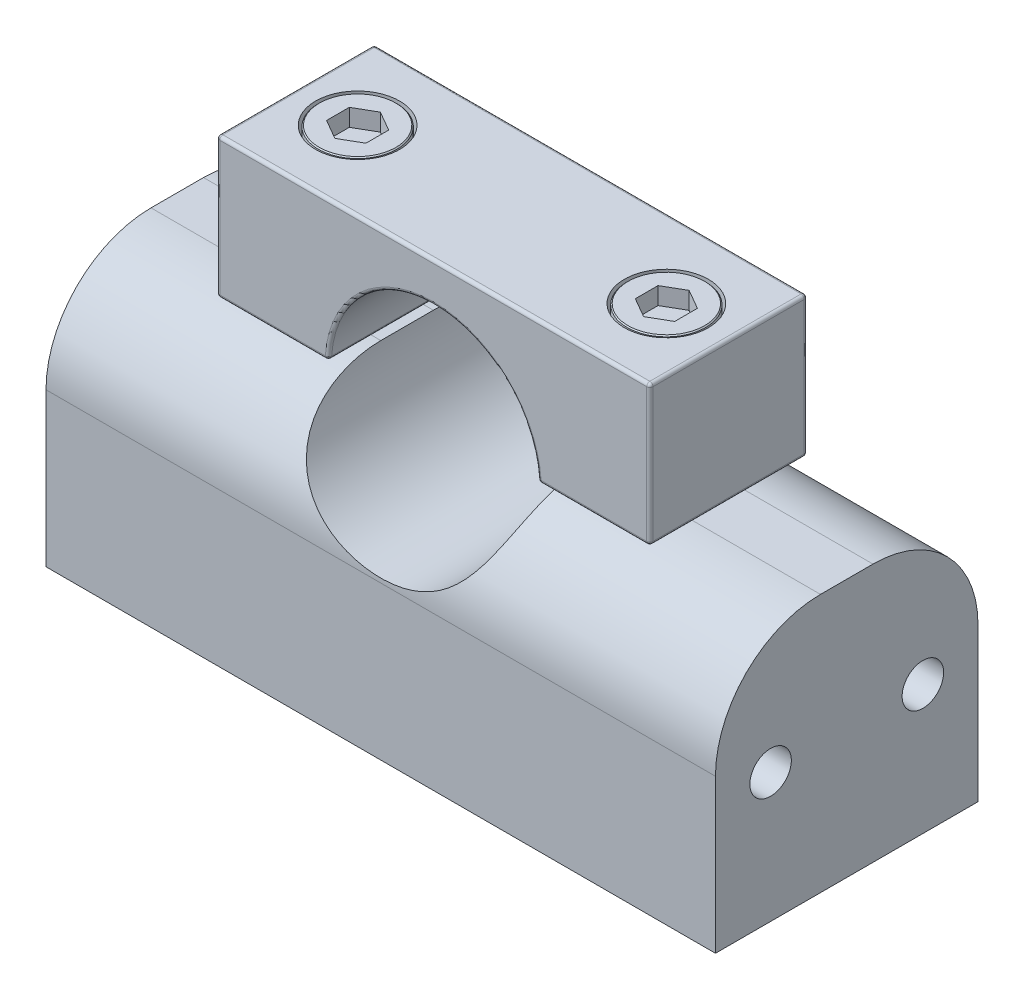
from build123d import *

# Parameters (mm, degrees)
BOSS_EXTRUDE1_DEPTH   = 19.05
BOSS_EXTRUDE1_2_DEPTH = 19.05
SKETCH10_R            = 3.429
CUT_EXTRUDE4_DEPTH    = 67.509429841
SKETCH12_R            = 5.08
CUT_EXTRUDE5_DEPTH    = 6.731
CHAMFER1_SIZE         = 0.127
CUT_EXTRUDE6_DEPTH    = 2.0955
FILLET1_R             = 0.381
BOSS_EXTRUDE2_START   = 6.35
BOSS_EXTRUDE2_DEPTH   = 6.35
BOSS_EXTRUDE3_START   = -19.05
BOSS_EXTRUDE3_DEPTH   = 6.35
SKETCH18_R            = 2.50825
CUT_EXTRUDE7_DEPTH    = 80.9625
FILLET2_R             = 12.7


with BuildPart() as part:
    # Sketch3 → Boss-Extrude1 (new body)
    with BuildSketch(Plane.XY):
        with BuildLine():
            Line((-26.19375, 49.2125), (26.19375, 49.2125))
            Line((26.19375, 49.2125), (26.19375, 32.258))
            Line((26.19375, 32.258), (12.689835933, 32.258))
            ThreePointArc((12.689835933, 32.258), (0, 44.45), (-12.689835933, 32.258))
            Line((-12.689835933, 32.258), (-26.19375, 32.258))
            Line((-26.19375, 32.258), (-26.19375, 49.2125))
        make_face()
    extrude(amount=-BOSS_EXTRUDE1_DEPTH)


with BuildPart() as body_2:
    # Sketch3 → Boss-Extrude1 2 (new body)
    with BuildSketch(Plane.XY):
        with BuildLine():
            Line((-40.48125, 0), (-40.48125, 9.8425))
            Line((-40.48125, 9.8425), (-40.48125, 31.242))
            Line((-40.48125, 31.242), (-26.19375, 31.242))
            Line((-26.19375, 31.242), (-12.689835933, 31.242))
            ThreePointArc((-12.689835933, 31.242), (0, 19.05), (12.689835933, 31.242))
            Line((12.689835933, 31.242), (26.19375, 31.242))
            Line((26.19375, 31.242), (40.48125, 31.242))
            Line((40.48125, 31.242), (40.48125, 9.8425))
            Line((40.48125, 9.8425), (40.48125, 0))
            Line((40.48125, 0), (-40.48125, 0))
        make_face()
    extrude(amount=-BOSS_EXTRUDE1_2_DEPTH)


with BuildPart() as cut_extrude4_tool:
    # Sketch10 → Cut-Extrude4 (new, through all)
    with BuildSketch(Plane(origin=(0, 49.2125, 0), x_dir=(1, 0, 0), z_dir=(0, 1, 0))):
        with Locations(Location((18.669, 9.525, 0), (0, 0, 270))):
            Circle(SKETCH10_R)
        with Locations(Location((-18.669, 9.525, 0), (0, 0, 180))):
            Circle(SKETCH10_R)
    extrude(amount=-CUT_EXTRUDE4_DEPTH)


with BuildPart() as part_1:
    add(part.part)

    # Cut-Extrude4: cut by cut_extrude4_tool
    add(cut_extrude4_tool.part, mode=Mode.SUBTRACT)

    # Sketch12 → Cut-Extrude5 (cut)
    with BuildSketch(Plane(origin=(0, 49.2125, 0), x_dir=(1, 0, 0), z_dir=(0, 1, 0))):
        with Locations((18.669, 9.525)):
            Circle(SKETCH12_R)
        with Locations(Location((-18.669, 9.525, 0), (0, 0, 180))):
            Circle(SKETCH12_R)
    extrude(amount=-CUT_EXTRUDE5_DEPTH, mode=Mode.SUBTRACT)

    # Fillet1
    fillet1_edges = [part_1.edges().sort_by_distance(p)[0] for p in [
        (0, 44.45, -19.05),
        (-26.19375, 49.2125, -9.525),
        (26.19375, 49.2125, -9.525),
        (26.19375, 32.258, -9.525),
        (12.689835933, 32.258, -9.525),
        (-12.689835933, 32.258, -9.525),
        (-26.19375, 32.258, -9.525),
        (19.441792966, 32.258, -19.05),
        (26.19375, 40.73525, -19.05),
        (0, 49.2125, -19.05),
        (-26.19375, 40.73525, -19.05),
        (0, 49.2125, 0),
        (26.19375, 40.73525, 0),
        (19.441792966, 32.258, 0),
        (-19.441792966, 32.258, -19.05),
        (0, 44.45, 0),
        (-19.441792966, 32.258, 0),
        (-26.19375, 40.73525, 0),
    ]]
    fillet(fillet1_edges, radius=FILLET1_R)


with BuildPart() as body_2_1:
    add(body_2.part)

    # Cut-Extrude4: cut by cut_extrude4_tool
    add(cut_extrude4_tool.part, mode=Mode.SUBTRACT)

    # Sketch17 → Boss-Extrude2 (add)
    with BuildSketch(Plane.XY.offset(BOSS_EXTRUDE2_START)):
        with BuildLine():
            Line((-12.689835933, 31.242), (-40.48125, 31.242))
            Line((-40.48125, 31.242), (-40.48125, 0))
            Line((-40.48125, 0), (40.48125, 0))
            Line((40.48125, 0), (40.48125, 31.242))
            Line((40.48125, 31.242), (12.689835933, 31.242))
            ThreePointArc((12.689835933, 31.242), (0, 19.05), (-12.689835933, 31.242))
        make_face()
    extrude(amount=-BOSS_EXTRUDE2_DEPTH)

    # Sketch17<2> → Boss-Extrude3 (add)
    with BuildSketch(Plane.XY.offset(BOSS_EXTRUDE3_START)):
        with BuildLine():
            Line((-12.689835933, 31.242), (-40.48125, 31.242))
            Line((-40.48125, 31.242), (-40.48125, 0))
            Line((-40.48125, 0), (40.48125, 0))
            Line((40.48125, 0), (40.48125, 31.242))
            Line((40.48125, 31.242), (12.689835933, 31.242))
            ThreePointArc((12.689835933, 31.242), (0, 19.05), (-12.689835933, 31.242))
        make_face()
    extrude(amount=-BOSS_EXTRUDE3_DEPTH)

    # Sketch18 → Cut-Extrude7 (cut)
    with BuildSketch(Plane.ZY.offset(40.48125)):
        with Locations((-18.7325, 15.621)):
            Circle(SKETCH18_R)
        with Locations((-0.3175, 15.621)):
            Circle(SKETCH18_R)
    extrude(amount=-CUT_EXTRUDE7_DEPTH, mode=Mode.SUBTRACT)

    # Fillet2
    # the kernel refuses this fillet: 12.7 mm, written as the material it takes off along each edge
    with BuildSketch(Plane(origin=(19.060164067, 31.242, 6.35), x_dir=(0, -1, 0), z_dir=(-1, 0, 0)), Plane(origin=(72.23125, 31.242, 6.35), x_dir=(0, -1, 0), z_dir=(-1, 0, 0))) as fillet2_piece_1:
        with BuildLine():
            CenterArc((FILLET2_R, -FILLET2_R), FILLET2_R, 90, 90)
            Line((0, -FILLET2_R), (0, 0))
            Line((0, 0), (FILLET2_R, 0))
        make_face()
    extrude(amount=91.291414067, mode=Mode.SUBTRACT)
    with BuildSketch(Plane(origin=(72.23125, 31.242, -25.4), x_dir=(0, -1, 0), z_dir=(-1, 0, 0)), Plane(origin=(19.060164067, 31.242, -25.4), x_dir=(0, -1, 0), z_dir=(-1, 0, 0))) as fillet2_piece_2:
        with BuildLine():
            CenterArc((FILLET2_R, FILLET2_R), FILLET2_R, 180, 90)
            Line((0, FILLET2_R), (0, 0))
            Line((0, 0), (FILLET2_R, 0))
        make_face()
    extrude(amount=91.291414067, mode=Mode.SUBTRACT)


with BuildPart() as body_3:
    # Sketch15 → Revolve1 (revolve)
    with BuildSketch(Plane.XY.offset(-9.525), mode=Mode.PRIVATE) as revolve1_sk:
        Polygon((-18.669, 19.685), (-18.669, 49.2125), (-23.4315, 49.2125), (-23.4315, 42.8625), (-21.844, 42.8625), (-21.844, 19.685), align=None)
    revolve(revolve1_sk.sketch.rotate(Axis((-18.669, 19.685, -9.525), (0, 1, 0)), 270), axis=Axis((-18.669, 19.685, -9.525), (0, 1, 0)))

    # Chamfer1
    chamfer1_edges = [body_3.edges().sort_by_distance(p)[0] for p in [
        (-18.669, 49.2125, -4.7625),
    ]]
    chamfer(chamfer1_edges, length=CHAMFER1_SIZE)

    # Sketch16 → Cut-Extrude6 (cut)
    with BuildSketch(Plane(origin=(0, 49.2125, 0), x_dir=(1, 0, 0), z_dir=(0, 1, 0))):
        Polygon((-18.669, 12.274630657), (-21.05025, 10.899815329), (-21.05025, 8.150184671), (-18.669, 6.775369343), (-16.28775, 8.150184671), (-16.28775, 10.899815329), align=None)
    extrude(amount=-CUT_EXTRUDE6_DEPTH, mode=Mode.SUBTRACT)


with BuildPart() as body_4:
    # Mirror1: mirrored copy
    add(body_3.part.mirror(Plane(origin=(0, 0, 0), x_dir=(0, 0, 1), z_dir=(1, 0, 0))))


solid = Compound([part_1.part, body_2_1.part, body_3.part, body_4.part])
